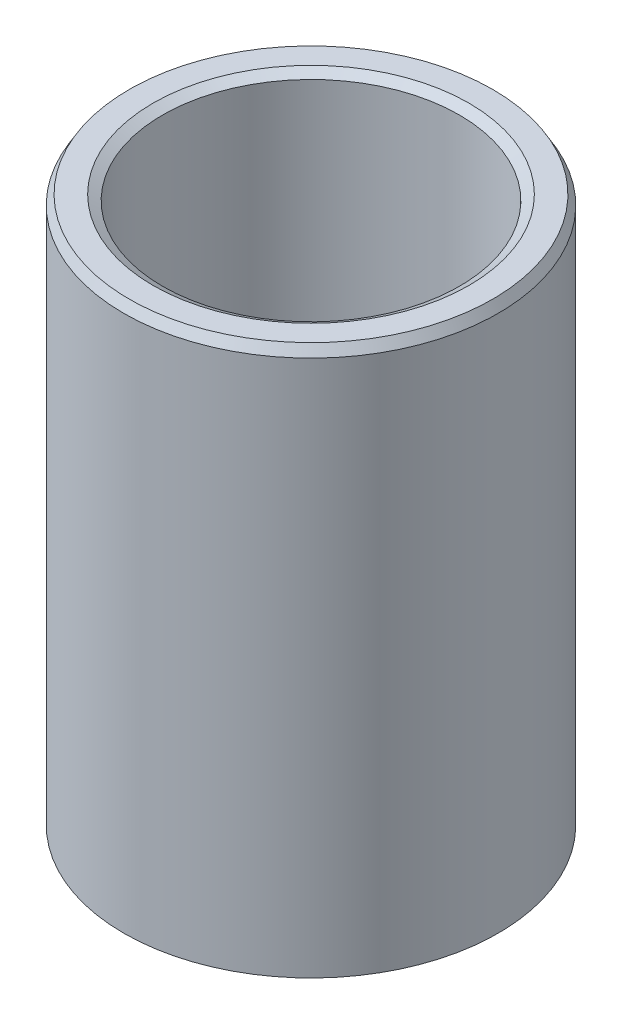
from build123d import *
from OCP.BRepFilletAPI import BRepFilletAPI_MakeChamfer

# Parameters (mm, degrees)
SKETCH1_R           = 27.5
BOSS_EXTRUDE1_DEPTH = 81.067047695
SKETCH2_R           = 21.801619182
CUT_EXTRUDE1_DEPTH  = 90.913103728
CHAMFER1_SIZE       = 1.400684844
CHAMFER1_SIZE2      = 0.808685772


with BuildPart() as part:
    # Sketch1 → Boss-Extrude1 (new body)
    with BuildSketch(Plane(origin=(0, 0, 0), x_dir=(1, 0, 0), z_dir=(0, 1, 0))):
        Circle(SKETCH1_R)
    extrude(amount=BOSS_EXTRUDE1_DEPTH)

    # Sketch2 → Cut-Extrude1 (cut, through all)
    with BuildSketch(Plane(origin=(0, 0, 0), x_dir=(1, 0, 0), z_dir=(0, 1, 0))):
        Circle(SKETCH2_R)
    extrude(amount=CUT_EXTRUDE1_DEPTH, mode=Mode.SUBTRACT)

    # Chamfer1: one chamfer whose edges measure the first distance from different faces: ONE call of the kernel's chamfer builder (chamfer() names one face for all edges)
    chamfer1_edges_1 = [part.edges().sort_by_distance(p)[0] for p in [
        (-21.801619182, 81.067047695, 0),
    ]]
    chamfer1_side_1 = [part.faces().sort_by_distance(p)[0] for p in [
        (-26.722182541, 81.067047695, 0),
    ]]
    chamfer1_edges_2 = [part.edges().sort_by_distance(p)[0] for p in [
        (-21.801619182, 0, 0),
    ]]
    chamfer1_side_2 = [part.faces().sort_by_distance(p)[0] for p in [
        (-21.801619182, 40.533523848, 0),
    ]]
    chamfer1_edges_3 = [part.edges().sort_by_distance(p)[0] for p in [
        (-27.5, 0, 0),
    ]]
    chamfer1_side_3 = [part.faces().sort_by_distance(p)[0] for p in [
        (-26.722182541, 0, 0),
    ]]
    chamfer1_edges_4 = [part.edges().sort_by_distance(p)[0] for p in [
        (-27.5, 81.067047695, 0),
    ]]
    chamfer1_side_4 = [part.faces().sort_by_distance(p)[0] for p in [
        (-27.5, 40.533523848, 0),
    ]]
    chamfer1 = BRepFilletAPI_MakeChamfer(part.part.solid().wrapped)
    for e in chamfer1_edges_1:
        chamfer1.Add(CHAMFER1_SIZE, CHAMFER1_SIZE2, e.wrapped, chamfer1_side_1[0].wrapped)  # the first distance lies on this face
    for e in chamfer1_edges_2:
        chamfer1.Add(CHAMFER1_SIZE, CHAMFER1_SIZE2, e.wrapped, chamfer1_side_2[0].wrapped)  # the first distance lies on this face
    for e in chamfer1_edges_3:
        chamfer1.Add(CHAMFER1_SIZE, CHAMFER1_SIZE2, e.wrapped, chamfer1_side_3[0].wrapped)  # the first distance lies on this face
    for e in chamfer1_edges_4:
        chamfer1.Add(CHAMFER1_SIZE, CHAMFER1_SIZE2, e.wrapped, chamfer1_side_4[0].wrapped)  # the first distance lies on this face
    add(Compound.cast(chamfer1.Shape()), mode=Mode.REPLACE)


solid = part.part
